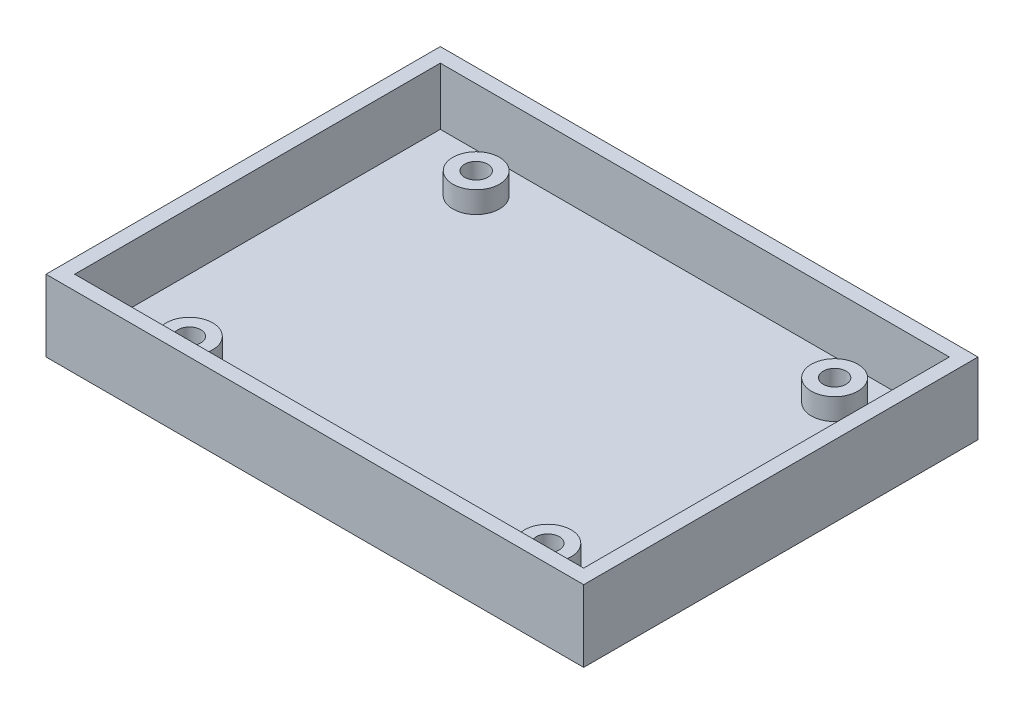
from build123d import *

# Parameters (mm, degrees)
SKETCH1_W             = 75
SKETCH1_H             = 55
BODY_DEPTH            = 10
SHELL1_T              = -2
SKETCH2_R             = 3.25
INSERTS_SUPPORT_DEPTH = 3
SKETCH3_R             = 1.6
INSERTS_HOLES_DEPTH   = 4


with BuildPart() as part:
    # Sketch1 → Body (new body)
    with BuildSketch(Plane(origin=(0, 0, 0), x_dir=(1, 0, 0), z_dir=(0, 1, 0))):
        Rectangle(SKETCH1_W, SKETCH1_H)
    extrude(amount=BODY_DEPTH)

    # Shell1
    shell1_openings = [part.faces().sort_by_distance(p)[0] for p in [
        (0, 10, 0),
    ]]
    offset(amount=SHELL1_T, openings=shell1_openings, kind=Kind.INTERSECTION)

    # Sketch2 → Inserts_Support (add)
    with BuildSketch(Plane(origin=(0, 2, 0), x_dir=(1, 0, 0), z_dir=(0, 1, 0))):
        with Locations((-25, 20)):
            Circle(SKETCH2_R)
        with Locations((25, 20)):
            Circle(SKETCH2_R)
        with Locations((25, -20)):
            Circle(SKETCH2_R)
        with Locations((-25, -20)):
            Circle(SKETCH2_R)
    extrude(amount=INSERTS_SUPPORT_DEPTH)

    # Sketch3 → Inserts_Holes (cut)
    with BuildSketch(Plane(origin=(0, 5, 0), x_dir=(1, 0, 0), z_dir=(0, 1, 0))):
        with Locations((-25, 20)):
            Circle(SKETCH3_R)
        with Locations((25, 20)):
            Circle(SKETCH3_R)
        with Locations((25, -20)):
            Circle(SKETCH3_R)
        with Locations((-25, -20)):
            Circle(SKETCH3_R)
    extrude(amount=-INSERTS_HOLES_DEPTH, mode=Mode.SUBTRACT)


solid = part.part
